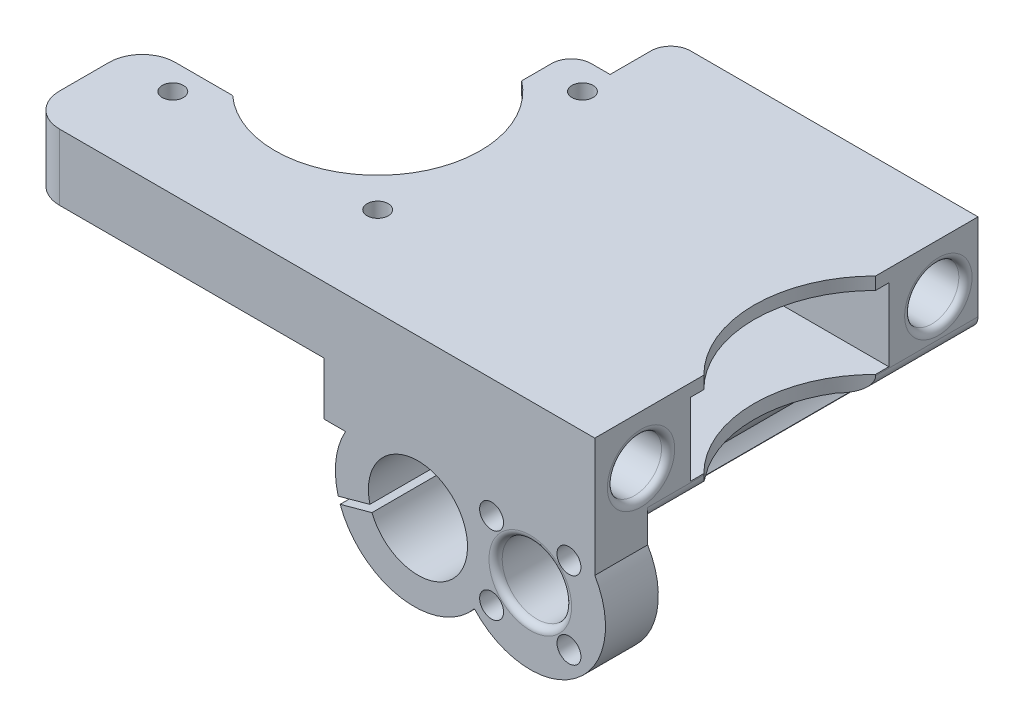
from build123d import *
from build123d.topology import SkipClean

# Parameters (mm, degrees)
CROQUIS2_R                  = 1.81
CROQUIS2_R_2                = 1.811366659
CROQUIS2_R_3                = 5
SALIENTE_EXTRUIR2_DEPTH     = 58
CROQUIS4_W                  = 30
CROQUIS4_H                  = 11
CORTAR_EXTRUIR4_DEPTH       = 87
CROQUIS6_R                  = 1.6
CORTAR_EXTRUIR5_DEPTH       = 18
CROQUIS7_W                  = 3
CROQUIS7_H                  = 11
SALIENTE_EXTRUIR3_DEPTH     = 12
CROQUIS8_W                  = 3
CROQUIS8_H                  = 11
SALIENTE_EXTRUIR4_DEPTH     = 45
CORTAR_EXTRUIR6_DEPTH       = 45
CORTAR_EXTRUIR7_DEPTH       = 6
CORTAR_EXTRUIR8_DEPTH       = 18
CROQUIS12_W                 = 2
CROQUIS12_H                 = 1.9
CORTAR_EXTRUIR9_DEPTH       = 33.637735
CORTAR_EXTRUIR10_START      = -10
CROQUIS13_R                 = 15.538783986
CORTAR_EXTRUIR10_DEPTH      = 10
CORTAR_EXTRUIR11_START      = -18
CROQUIS15_R                 = 1.6
CORTAR_EXTRUIR11_DEPTH      = 18
CROQUIS16_R                 = 3
CORTAR_EXTRUIR12_DEPTH      = 4
CORTAR_EXTRUIR16_START      = -50
CROQUIS3_R                  = 1.811366659
CROQUIS3_R_2                = 1.81
CROQUIS3_R_3                = 5
CORTAR_EXTRUIR16_DEPTH      = 50
CROQUIS18_R                 = 4.1
CORTAR_EXTRUIR17_DEPTH      = 42
CORTAR_EXTRUIR19_DEPTH      = 86.287799889
CORTAR_EXTRUIR19_DEPTH_BACK = 19
REDONDEO1_R                 = 5
REDONDEO2_R                 = 5
REDONDEO3_R                 = 2
REDONDEO4_R                 = 1
SALIENTE_EXTRUIR5_START     = -58
CROQUIS20_R                 = 7.762999965
CROQUIS20_R_2               = 7.5
SALIENTE_EXTRUIR5_DEPTH     = 58
CORTAR_EXTRUIR20_START      = -58
CORTAR_EXTRUIR20_DEPTH      = 58
CORTAR_EXTRUIR21_START      = -8
CROQUIS22_R                 = 5.25
CROQUIS22_R_2               = 5
CORTAR_EXTRUIR21_DEPTH      = 8
REDONDEO6_R                 = 1
CROQUIS17_R                 = 2.95
CORTAR_EXTRUIR22_DEPTH      = 12
CROQUIS23_W                 = 6
CROQUIS23_H                 = 6
SALIENTE_EXTRUIR6_DEPTH     = 8
CROQUIS24_R                 = 1.45
CORTAR_EXTRUIR23_DEPTH      = 8
REDONDEO7_R                 = 3
REDONDEO8_R                 = 2


with BuildPart() as part:
    # Croquis2 → Saliente-Extruir2 (new body)
    # profile 1 of 2: a face of its own
    with BuildSketch(Plane.XY):
        with BuildLine():
            Line((-51.296582303, 10.52765343), (-3.021111794, 10.52765343))
            ThreePointArc((-3.021111794, 10.52765343), (2.658948602, 15.615568942), (10.261175847, 16.212319545))
            ThreePointArc((10.261175847, 16.212319545), (10.994920637, 16.001486452), (11.713641148, 15.74405134))
            ThreePointArc((11.713641148, 15.74405134), (14.314690486, 14.320028149), (16.483037003, 12.297264423))
            ThreePointArc((16.483037003, 12.297264423), (26.039251667, 16.004842725), (34.703417697, 10.52765343))
            Line((34.703417697, 10.52765343), (34.703417697, 28.52765343))
            Line((34.703417697, 28.52765343), (-51.296582303, 28.52765343))
            Line((-51.296582303, 28.52765343), (-51.296582303, 10.52765343))
        make_face()
    # profile 2 of 2: a face of its own
    with BuildSketch(Plane.XY):
        with BuildLine():
            ThreePointArc((10.261175847, 16.212319545), (2.658948602, 15.615568942), (-3.021111794, 10.52765343))
            ThreePointArc((-3.021111794, 10.52765343), (-4.56078153, 4.672432185), (-3.021111794, -1.182789061))
            ThreePointArc((-3.021111794, -1.182789061), (1.08700104, -5.454594795), (6.74587135, -7.215873335))
            ThreePointArc((6.74587135, -7.215873335), (7.342485083, -7.230834429), (7.939098816, -7.215873335))
            ThreePointArc((7.939098816, -7.215873335), (12.657313381, -5.978406103), (16.483037003, -2.952400054))
            ThreePointArc((16.483037003, -2.952400054), (26.039251667, -6.659978355), (34.703417697, -1.182789061))
            ThreePointArc((34.703417697, -1.182789061), (36.324351619, 4.672432185), (34.703417697, 10.52765343))
            ThreePointArc((34.703417697, 10.52765343), (26.039251667, 16.004842725), (16.483037003, 12.297264423))
            ThreePointArc((16.483037003, 12.297264423), (14.314690486, 14.320028149), (11.713641148, 15.74405134))
            ThreePointArc((11.713641148, 15.74405134), (10.994920637, 16.001486452), (10.261175847, 16.212319545))
        make_face()
        with Locations((19.083397092, -1.18234657)):
            Circle(CROQUIS2_R, mode=Mode.SUBTRACT)
        with Locations((30.793839583, -1.182789061)):
            Circle(CROQUIS2_R_2, mode=Mode.SUBTRACT)
        with BuildLine():
            ThreePointArc((15.705485048, 4.672432185), (13.638785674, -0.601686513), (8.539098816, -3.0676079))
            ThreePointArc((8.539098816, -3.0676079), (7.942485083, -3.09056778), (7.34587135, -3.0676079))
            ThreePointArc((7.34587135, -3.0676079), (0.281539843, 5.927058219), (9.84597906, 12.19844568))
            ThreePointArc((9.84597906, 12.19844568), (10.524835531, 11.993336133), (11.182141794, 11.727132239))
            ThreePointArc((11.182141794, 11.727132239), (14.477529972, 8.862582154), (15.705485048, 4.672432185))
        make_face(mode=Mode.SUBTRACT)
        with Locations((24.938618337, 4.672432185)):
            Circle(CROQUIS2_R_3, mode=Mode.SUBTRACT)
        with Locations((19.083397092, 10.52765343)):
            Circle(CROQUIS2_R_2, mode=Mode.SUBTRACT)
        with Locations((30.793839583, 10.52765343)):
            Circle(CROQUIS2_R_2, mode=Mode.SUBTRACT)
    extrude(amount=-SALIENTE_EXTRUIR2_DEPTH)

    # Croquis4 → Cortar-Extruir4 (cut)
    with BuildSketch(Plane(origin=(34.703417697, 0, 0), x_dir=(0, 0, -1), z_dir=(1, 0, 0))):
        with Locations((29.5, 21.12765343)):
            Rectangle(CROQUIS4_W, CROQUIS4_H)
    extrude(amount=-CORTAR_EXTRUIR4_DEPTH, mode=Mode.SUBTRACT)

    # Croquis6 → Cortar-Extruir5 (cut)
    with BuildSketch(Plane.XZ.offset(-10.52765343)):
        Polygon((-51.296582303, -19.5), (-51.296582303, -44.5), (-51.296582303, -58), (-17.658847049, -58), (-17.658847049, -19.5), align=None)
        with Locations((-11.658847049, -13.5)):
            Circle(CROQUIS6_R)
        with Locations((-42.658847049, -13.5)):
            Circle(CROQUIS6_R)
        with Locations((-11.658847049, -44.5)):
            Circle(CROQUIS6_R)
    extrude(amount=-CORTAR_EXTRUIR5_DEPTH, mode=Mode.SUBTRACT)

    # Croquis7 → Saliente-Extruir3 (add)
    with BuildSketch(Plane.ZY.offset(17.658847049)):
        with Locations((-43, 21.12765343)):
            Rectangle(CROQUIS7_W, CROQUIS7_H)
    extrude(amount=-SALIENTE_EXTRUIR3_DEPTH)

    # Croquis8 → Saliente-Extruir4 (add)
    with BuildSketch(Plane.ZY.offset(51.296582303)):
        with Locations((-16, 21.12765343)):
            Rectangle(CROQUIS8_W, CROQUIS8_H)
    extrude(amount=-SALIENTE_EXTRUIR4_DEPTH)

    # Croquis9 → Cortar-Extruir6 (cut)
    with BuildSketch(Plane.ZY.offset(51.296582303)):
        Polygon((0, 18.52765343), (-17.5, 18.52765343), (-17.5, 15.62765343), (-19.5, 15.62765343), (-19.5, 10.52765343), (0, 10.52765343), align=None)
    extrude(amount=-CORTAR_EXTRUIR6_DEPTH, mode=Mode.SUBTRACT)

    # Croquis10 → Cortar-Extruir7 (cut)
    with BuildSketch(Plane.XZ.offset(-10.52765343)):
        Polygon((-6.296582303, -19.5), (-17.658847049, -35.539203183), (-17.658847049, -19.5), align=None)
    extrude(amount=-CORTAR_EXTRUIR7_DEPTH, mode=Mode.SUBTRACT)

    # Croquis11 → Cortar-Extruir8 (cut)
    with BuildSketch(Plane.XZ.offset(-10.52765343)):
        Polygon((-13.562286071, -58), (-11.800055192, -58), (-11.800055192, -48.818907414), (-13.562286071, -48.818907414), (-17.658847049, -48.818907414), (-17.658847049, -58), align=None)
    extrude(amount=-CORTAR_EXTRUIR8_DEPTH, mode=Mode.SUBTRACT)

    # Croquis12 → Cortar-Extruir9 (cut)
    with SkipClean():  # the faces are left unmerged after this step: merging them gives an invalid solid
        with BuildSketch(Plane.ZY.offset(51.296582303)):
            with Locations((-18.5, 27.57765343)):
                Rectangle(CROQUIS12_W, CROQUIS12_H)
        extrude(amount=-CORTAR_EXTRUIR9_DEPTH, mode=Mode.SUBTRACT)

    # Croquis13 → Cortar-Extruir10 (cut)
    with BuildSketch(Plane(origin=(0, 28.52765343, 0), x_dir=(1, 0, 0), z_dir=(0, 1, 0)).offset(CORTAR_EXTRUIR10_START)):
        with Locations((-27.158847049, 29)):
            Circle(CROQUIS13_R)
    extrude(amount=CORTAR_EXTRUIR10_DEPTH, mode=Mode.SUBTRACT)

    # Croquis15 → Cortar-Extruir11 (cut)
    with SkipClean():  # the faces are left unmerged after this step: merging them gives an invalid solid
        with BuildSketch(Plane(origin=(0, 28.52765343, 0), x_dir=(1, 0, 0), z_dir=(0, 1, 0)).offset(CORTAR_EXTRUIR11_START)):
            with Locations((-11.658847049, 44.5)):
                Circle(CROQUIS15_R)
            with Locations((-11.658847049, 13.5)):
                Circle(CROQUIS15_R)
            with Locations((-42.658847049, 13.5)):
                Circle(CROQUIS15_R)
        extrude(amount=CORTAR_EXTRUIR11_DEPTH, mode=Mode.SUBTRACT)

    # Croquis16 → Cortar-Extruir12 (cut)
    with SkipClean():  # the faces are left unmerged after this step: merging them gives an invalid solid
        with BuildSketch(Plane.XZ.offset(-18.52765343)):
            with Locations(Location((-11.658847049, -13.5, 0), (0, 0, 270))):
                Circle(CROQUIS16_R)
            with Locations(Location((-42.658847049, -13.5, 0), (0, 0, 270))):
                Circle(CROQUIS16_R)
        extrude(amount=-CORTAR_EXTRUIR12_DEPTH, mode=Mode.SUBTRACT)

    # Croquis3 → Cortar-Extruir16 (cut)
    with SkipClean():  # the faces are left unmerged after this step: merging them gives an invalid solid
        with BuildSketch(Plane(origin=(0, 0, -58), x_dir=(-1, 0, 0), z_dir=(0, 0, -1)).offset(CORTAR_EXTRUIR16_START)):
            with BuildLine():
                Line((-17.781804866, 13.52765343), (-32.095431809, 13.52765343))
                ThreePointArc((-32.095431809, 13.52765343), (-33.53136209, 12.142350335), (-34.703417697, 10.52765343))
                ThreePointArc((-34.703417697, 10.52765343), (-31.710359136, -4.480624623), (-16.483037003, -2.952400054))
                ThreePointArc((-16.483037003, -2.952400054), (-15.856775383, -2.194521355), (-15.298229788, -1.385441287))
                ThreePointArc((-15.298229788, -1.385441287), (-15.280577399, -1.357258323), (-15.263007401, -1.329023921))
                ThreePointArc((-15.263007401, -1.329023921), (-17.408610077, 4.672432185), (-15.263007401, 10.67388829))
                ThreePointArc((-15.263007401, 10.67388829), (-15.280577399, 10.702122692), (-15.298229788, 10.730305656))
                ThreePointArc((-15.298229788, 10.730305656), (-16.424348693, 12.231673866), (-17.781804866, 13.52765343))
            make_face()
            with Locations(Location((-30.793839583, -1.182789061, 0), (0, 0, 180))):
                Circle(CROQUIS3_R, mode=Mode.SUBTRACT)
            with Locations(Location((-19.083397092, -1.18234657, 0), (0, 0, 180))):
                Circle(CROQUIS3_R_2, mode=Mode.SUBTRACT)
            with Locations(Location((-30.793839583, 10.52765343, 0), (0, 0, 180))):
                Circle(CROQUIS3_R, mode=Mode.SUBTRACT)
            with Locations(Location((-24.938618337, 4.672432185, 0), (0, 0, 180))):
                Circle(CROQUIS3_R_3, mode=Mode.SUBTRACT)
            with Locations(Location((-19.083397092, 10.52765343, 0), (0, 0, 180))):
                Circle(CROQUIS3_R, mode=Mode.SUBTRACT)
        extrude(amount=CORTAR_EXTRUIR16_DEPTH, mode=Mode.SUBTRACT)

    # Croquis18 → Cortar-Extruir17 (cut)
    with SkipClean():  # the faces are left unmerged after this step: merging them gives an invalid solid
        with BuildSketch(Plane(origin=(34.703417697, 0, 0), x_dir=(0, 0, -1), z_dir=(1, 0, 0))):
            with Locations((7, 21.07765343)):
                Circle(CROQUIS18_R)
            with Locations((52, 21.07765343)):
                Circle(CROQUIS18_R)
        extrude(amount=-CORTAR_EXTRUIR17_DEPTH, mode=Mode.SUBTRACT)

    # Croquis19 → Cortar-Extruir19 (cut, two sides: drawn at the far end of the back side and taken through both)
    with SkipClean():  # the faces are left unmerged after this step: merging them gives an invalid solid
        with BuildSketch(Plane(origin=(0, 28.52765343, 0), x_dir=(1, 0, 0), z_dir=(0, 1, 0)).offset(-CORTAR_EXTRUIR19_DEPTH_BACK)):
            with BuildLine():
                Line((177.437671377, 185.23425368), (34.703417697, 42.5))
                ThreePointArc((34.703417697, 42.5), (29.318641386, 29.5), (34.703417697, 16.5))
                Line((34.703417697, 16.5), (177.437671377, -126.23425368))
                Line((177.437671377, -126.23425368), (581.151106118, -126.23425368))
                Line((581.151106118, -126.23425368), (581.151106118, 185.23425368))
                Line((581.151106118, 185.23425368), (177.437671377, 185.23425368))
            make_face()
        extrude(amount=CORTAR_EXTRUIR19_DEPTH + CORTAR_EXTRUIR19_DEPTH_BACK, mode=Mode.SUBTRACT)

    # Redondeo1
    # the kernel refuses this fillet: 5 mm, written as the material it takes off along each edge
    with BuildSketch(Plane(origin=(-51.296582303, 41.02765343, -17.5), x_dir=(0, 0, 1), z_dir=(0, -1, 0))) as redondeo1_piece_1:
        with BuildLine():
            CenterArc((REDONDEO1_R, -REDONDEO1_R), REDONDEO1_R, 90, 90)
            Line((0, -REDONDEO1_R), (0, 0))
            Line((0, 0), (REDONDEO1_R, 0))
        make_face()
    extrude(amount=35, mode=Mode.SUBTRACT)
    with BuildSketch(Plane(origin=(-5.658847049, 26.62765343, -41.5), x_dir=(-1, 0, 0), z_dir=(0, -1, 0))) as redondeo1_piece_2:
        with BuildLine():
            CenterArc((4.582575695, 5), REDONDEO1_R, 203.578178478, 66.421821522)
            Line((0, 3), (0, 0))
            Line((0, 0), (4.582575695, 0))
        make_face()
    extrude(amount=11, mode=Mode.SUBTRACT)
    with BuildSketch(Plane(origin=(-6.296582303, 26.62765343, -17.5), x_dir=(-1, 0, 0), z_dir=(0, -1, 0))) as redondeo1_piece_3:
        with BuildLine():
            CenterArc((4.582575695, -5), REDONDEO1_R, 90, 66.421821522)
            Line((0, -3), (0, 0))
            Line((0, 0), (4.582575695, 0))
        make_face()
    extrude(amount=19.556439237, mode=Mode.SUBTRACT)

    # Redondeo2
    redondeo2_edges = [part.edges().sort_by_distance(p)[0] for p in [
        (-51.296582303, 23.52765343, 0),
    ]]
    fillet(redondeo2_edges, radius=REDONDEO2_R)

    # Redondeo3
    # the kernel refuses this fillet: 2 mm, written as the material it takes off along each edge
    with BuildSketch(Plane(origin=(34.703417697, 10.52765343, -8), x_dir=(0, 1, 0), z_dir=(0, 0, -1))) as redondeo3_piece_1:
        with BuildLine():
            CenterArc((4.905348566, -2), REDONDEO3_R, 90, 107.697587282)
            ThreePointArc((3, -2.607985888), (1.614696905, -1.172055607), (0, 0))
            Line((0, 0), (4.905348566, 0))
        make_face()
    extrude(amount=20.763371416, mode=Mode.SUBTRACT)
    with BuildSketch(Plane(origin=(34.703417697, 10.52765343, -30.236628584), x_dir=(0, 1, 0), z_dir=(0, 0, -1))) as redondeo3_piece_2:
        with BuildLine():
            CenterArc((4.905348566, -2), REDONDEO3_R, 90, 107.697587282)
            ThreePointArc((3, -2.607985888), (1.614696905, -1.172055607), (0, 0))
            Line((0, 0), (4.905348566, 0))
        make_face()
    extrude(amount=40.026742832, mode=Mode.SUBTRACT)

    # Redondeo4
    redondeo4_edges = [part.edges().sort_by_distance(p)[0] for p in [
        (34.703417697, 21.07765343, -2.9),
        (34.703417697, 21.07765343, -47.9),
    ]]
    fillet(redondeo4_edges, radius=REDONDEO4_R)

    # Croquis20 → Saliente-Extruir5 (add)
    with BuildSketch(Plane(origin=(0, 0, -58), x_dir=(-1, 0, 0), z_dir=(0, 0, -1)).offset(SALIENTE_EXTRUIR5_START)):
        with Locations((-7.942485083, 4.672432185)):
            Circle(CROQUIS20_R)
        with Locations((-7.942485083, 4.672432185)):
            Circle(CROQUIS20_R_2, mode=Mode.SUBTRACT)
    extrude(amount=SALIENTE_EXTRUIR5_DEPTH)

    # Croquis21 → Cortar-Extruir20 (cut)
    with BuildSketch(Plane(origin=(0, 0, -58), x_dir=(-1, 0, 0), z_dir=(0, 0, -1)).offset(CORTAR_EXTRUIR20_START)):
        with BuildLine():
            Line((-0.673437857, 2.825555786), (4.129022296, 1.495598146))
            ThreePointArc((4.129022296, 1.495598146), (3.991345512, 1.034845056), (3.835170804, 0.580028865))
            Line((3.835170804, 0.580028865), (-0.975687749, 1.895071044))
            ThreePointArc((-0.975687749, 1.895071044), (-0.809374398, 2.355379757), (-0.673437857, 2.825555786))
        make_face()
    extrude(amount=CORTAR_EXTRUIR20_DEPTH, mode=Mode.SUBTRACT)

    # Croquis22 → Cortar-Extruir21 (cut)
    with BuildSketch(Plane(origin=(0, 0, -8), x_dir=(-1, 0, 0), z_dir=(0, 0, -1)).offset(CORTAR_EXTRUIR21_START)):
        with Locations((-24.938618337, 4.672432185)):
            Circle(CROQUIS22_R)
        with Locations((-24.938618337, 4.672432185)):
            Circle(CROQUIS22_R_2, mode=Mode.SUBTRACT)
    extrude(amount=CORTAR_EXTRUIR21_DEPTH, mode=Mode.SUBTRACT)

    # Redondeo6
    redondeo6_edges = [part.edges().sort_by_distance(p)[0] for p in [
        (30.188618337, 4.672432185, 0),
    ]]
    fillet(redondeo6_edges, radius=REDONDEO6_R)

    # Croquis17 → Cortar-Extruir22 (cut)
    with BuildSketch(Plane.XZ.offset(-10.52765343)):
        with Locations((-11.658847049, -44.5)):
            Circle(CROQUIS17_R)
    extrude(amount=-CORTAR_EXTRUIR22_DEPTH, mode=Mode.SUBTRACT)

    # Croquis23 → Saliente-Extruir6 (add)
    with BuildSketch(Plane(origin=(0, 0, -58), x_dir=(-1, 0, 0), z_dir=(0, 0, -1))):
        with Locations((6.021111794, 7.52765343)):
            Rectangle(CROQUIS23_W, CROQUIS23_H)
    extrude(amount=-SALIENTE_EXTRUIR6_DEPTH)

    # Croquis24 → Cortar-Extruir23 (cut)
    with BuildSketch(Plane(origin=(0, 0, -58), x_dir=(-1, 0, 0), z_dir=(0, 0, -1))):
        with Locations((7.021111794, 7.52765343)):
            Circle(CROQUIS24_R)
    extrude(amount=-CORTAR_EXTRUIR23_DEPTH, mode=Mode.SUBTRACT)

    # Redondeo7
    redondeo7_edges = [part.edges().sort_by_distance(p)[0] for p in [
        (-11.800055192, 19.52765343, -58),
        (-17.658847049, 19.52765343, -48.818907414),
    ]]
    fillet(redondeo7_edges, radius=REDONDEO7_R)

    # Redondeo8
    redondeo8_edges = [part.edges().sort_by_distance(p)[0] for p in [
        (-9.021111794, 4.52765343, -53.995922289),
    ]]
    fillet(redondeo8_edges, radius=REDONDEO8_R)


solid = part.part
